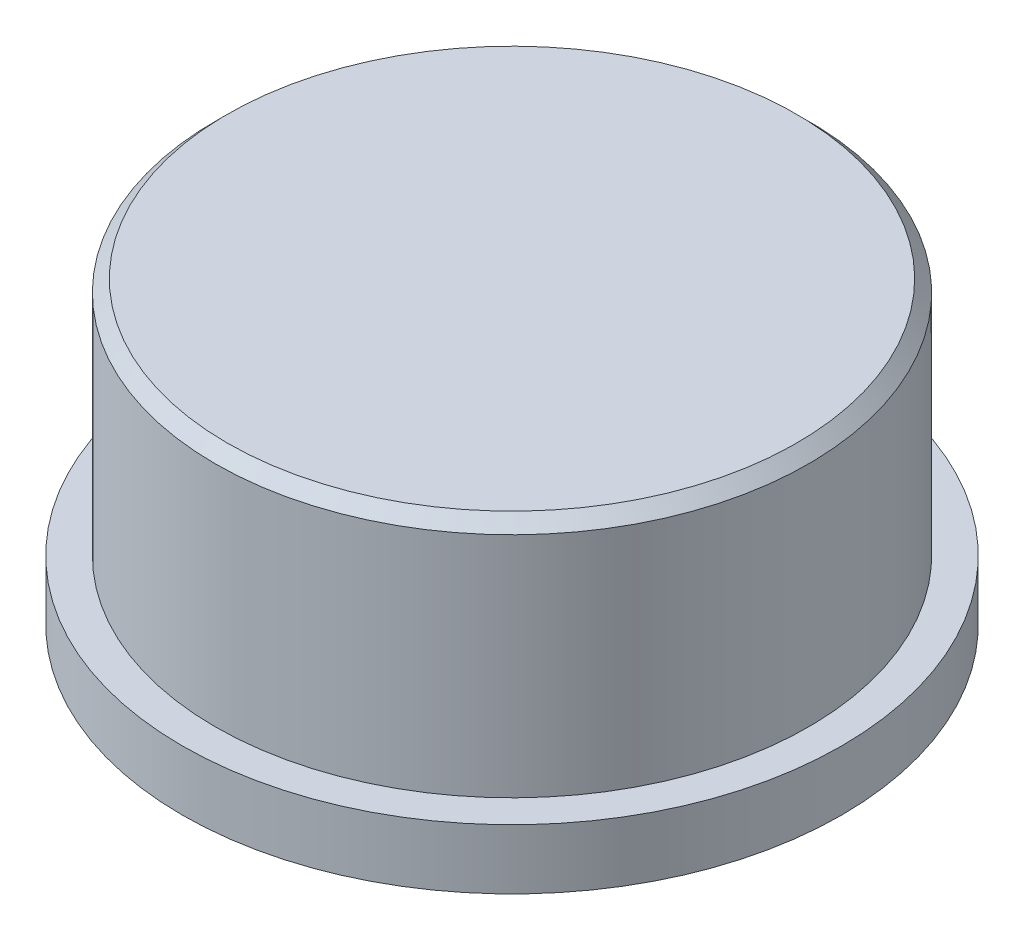
from build123d import *

# Parameters (mm, degrees)
SKETCH1_R           = 5.5
BOSS_EXTRUDE1_DEPTH = 1
SKETCH2_R           = 4.95
BOSS_EXTRUDE2_DEPTH = 4
CUT_EXTRUDE1_DEPTH  = 4
CHAMFER1_SIZE       = 0.2


with BuildPart() as part:
    # Sketch1 → Boss-Extrude1 (new body)
    with BuildSketch(Plane(origin=(0, 0, 0), x_dir=(1, 0, 0), z_dir=(0, 1, 0))):
        Circle(SKETCH1_R)
    extrude(amount=BOSS_EXTRUDE1_DEPTH)

    # Sketch2 → Boss-Extrude2 (add)
    with BuildSketch(Plane(origin=(0, 1, 0), x_dir=(1, 0, 0), z_dir=(0, 1, 0))):
        Circle(SKETCH2_R)
    extrude(amount=BOSS_EXTRUDE2_DEPTH)

    # Sketch3 → Cut-Extrude1 (cut)
    with BuildSketch(Plane.XZ):
        Polygon((2.944486373, 0), (1.472243186, 2.55), (-1.472243186, 2.55), (-2.944486373, 0), (-1.472243186, -2.55), (1.472243186, -2.55), align=None)
    extrude(amount=-CUT_EXTRUDE1_DEPTH, mode=Mode.SUBTRACT)

    # Chamfer1
    chamfer1_edges = [part.edges().sort_by_distance(p)[0] for p in [
        (-4.95, 5, 0),
    ]]
    chamfer(chamfer1_edges, length=CHAMFER1_SIZE)


solid = part.part
